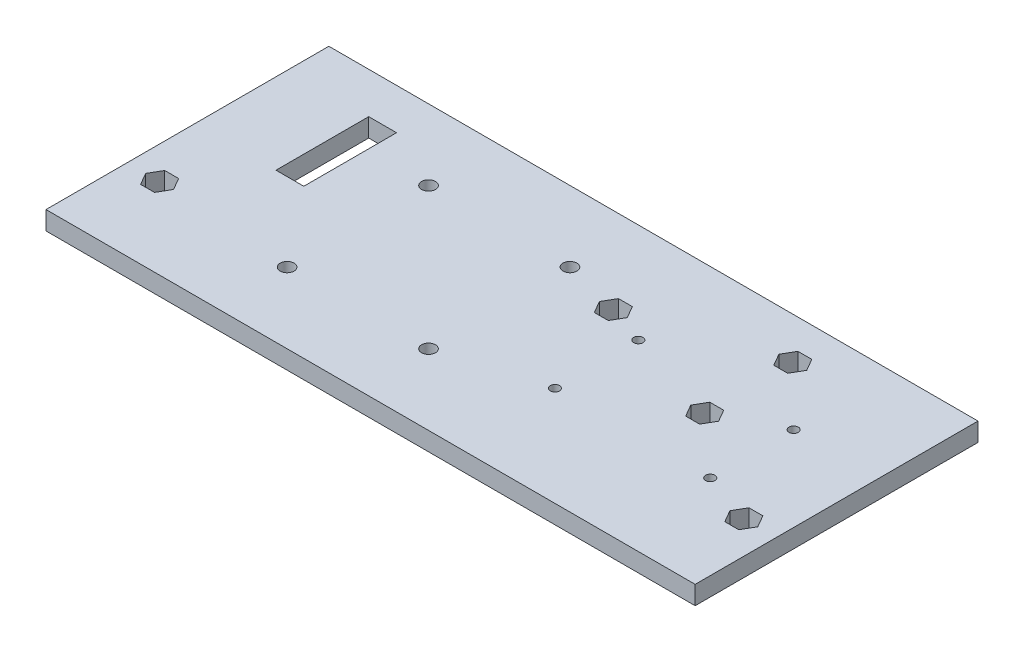
from build123d import *

# Parameters (mm, degrees)
SKETCH1_W           = 140
SKETCH1_H           = 61
BOSS_EXTRUDE1_DEPTH = 4
SKETCH2_W           = 6
SKETCH2_H           = 20
CUT_EXTRUDE1_DEPTH  = 10
SKETCH4_3_R         = 1
SKETCH4_3_R_2       = 1.5
CUT_EXTRUDE3_DEPTH  = 4
CUT_EXTRUDE4_DEPTH  = 34
CUT_EXTRUDE5_DEPTH  = 10


with BuildPart() as part:
    # Sketch1 → Boss-Extrude1 (new body)
    with BuildSketch(Plane(origin=(0, 0, 0), x_dir=(1, 0, 0), z_dir=(0, 1, 0))):
        with Locations((70, 0)):
            Rectangle(SKETCH1_W, SKETCH1_H)
    extrude(amount=BOSS_EXTRUDE1_DEPTH)

    # Sketch2 → Cut-Extrude1 (cut)
    with BuildSketch(Plane(origin=(0, 4, 0), x_dir=(1, 0, 0), z_dir=(0, 1, 0))):
        with Locations((20.449723582, 11.650059082)):
            Rectangle(SKETCH2_W, SKETCH2_H)
    extrude(amount=-CUT_EXTRUDE1_DEPTH, mode=Mode.SUBTRACT)

    # Sketch4<3> → Cut-Extrude3 (cut)
    with BuildSketch(Plane.XZ):
        with Locations((88.25, -9)):
            Circle(SKETCH4_3_R)
        with Locations((88.25, 9)):
            Circle(SKETCH4_3_R)
        with Locations((121.75, -9)):
            Circle(SKETCH4_3_R)
        with Locations((121.75, 9)):
            Circle(SKETCH4_3_R)
        with Locations((36.75, 15.25)):
            Circle(SKETCH4_3_R_2)
        with Locations((67.25, 15.25)):
            Circle(SKETCH4_3_R_2)
        with Locations((67.25, -15.25)):
            Circle(SKETCH4_3_R_2)
        with Locations((36.75, -15.25)):
            Circle(SKETCH4_3_R_2)
    extrude(amount=-CUT_EXTRUDE3_DEPTH, mode=Mode.SUBTRACT)

    # Sketch6 → Cut-Extrude4 (cut)
    with BuildSketch(Plane(origin=(0, 4, 0), x_dir=(1, 0, 0), z_dir=(0, 1, 0))):
        Polygon((81.358539738, 14.6), (78.356318338, 14.6), (76.855207639, 12), (78.356318338, 9.4), (81.358539738, 9.4), (82.859650438, 12), align=None)
        Polygon((110.558539738, 5.1), (107.556318338, 5.1), (106.055207639, 2.5), (107.556318338, -0.1), (110.558539738, -0.1), (112.059650438, 2.5), align=None)
        Polygon((112.059650438, 21.5), (110.558539738, 24.1), (107.556318338, 24.1), (106.055207639, 21.5), (107.556318338, 18.9), (110.558539738, 18.9), align=None)
    extrude(amount=-CUT_EXTRUDE4_DEPTH, mode=Mode.SUBTRACT)

    # Sketch7 → Cut-Extrude5 (cut)
    with BuildSketch(Plane(origin=(0, 4, 0), x_dir=(1, 0, 0), z_dir=(0, 1, 0))):
        Polygon((10.0022214, -13), (8.5011107, -10.4), (5.4988893, -10.4), (3.9977786, -13), (5.4988893, -15.6), (8.5011107, -15.6), align=None)
        Polygon((136.0022214, -13), (134.5011107, -10.4), (131.4988893, -10.4), (129.9977786, -13), (131.4988893, -15.6), (134.5011107, -15.6), align=None)
    extrude(amount=-CUT_EXTRUDE5_DEPTH, mode=Mode.SUBTRACT)


solid = part.part
